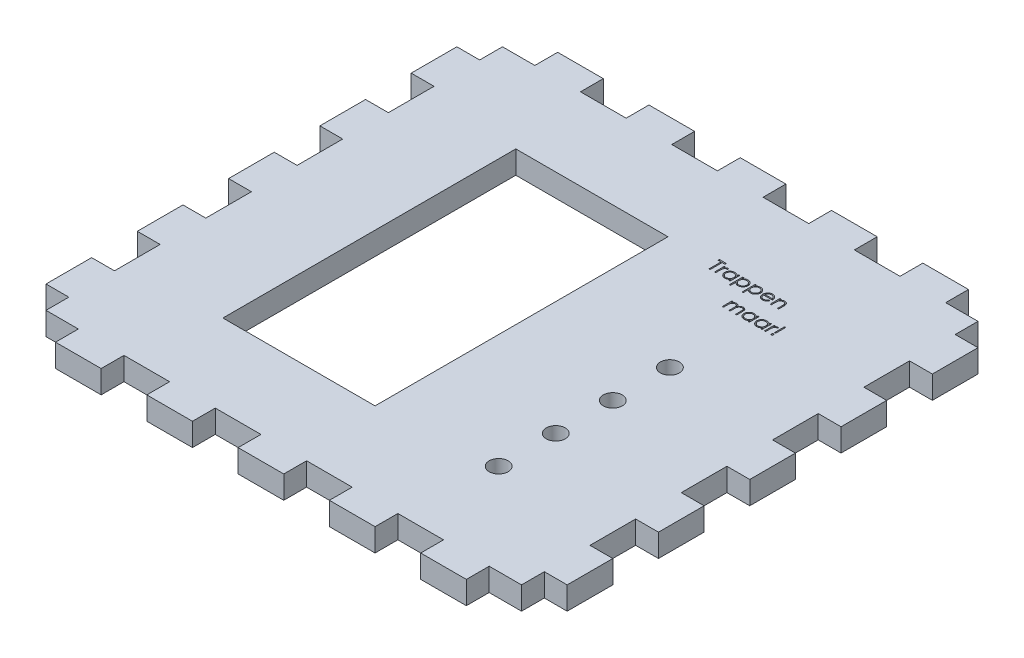
from build123d import *

# Parameters (mm, degrees)
SKETCH1_R           = 2.5
SKETCH1_W           = 40
SKETCH1_H           = 77
BOSS_EXTRUDE2_DEPTH = 6
SKETCH2_W           = 0.314102564
SKETCH2_H           = 2.692307693
CUT_EXTRUDE1_DEPTH  = 96.31133196


with BuildPart() as part:
    # Sketch1 → Boss-Extrude2 (new body)
    with BuildSketch(Plane(origin=(0, 0, 0), x_dir=(1, 0, 0), z_dir=(0, 1, 0))):
        Polygon((-62.5, -54), (-62.5, -60), (-54, -60), (-54, -66), (-42, -66), (-42, -60), (-30, -60), (-30, -66), (-18, -66), (-18, -60), (-6, -60), (-6, -66), (6, -66), (6, -60), (18, -60), (18, -66), (30, -66), (30, -60), (42, -60), (42, -66), (54, -66), (54, -60), (62.5, -60), (62.5, -54), (68.5, -54), (68.5, -42), (62.5, -42), (62.5, -30), (68.5, -30), (68.5, -18), (62.5, -18), (62.5, -6), (68.5, -6), (68.5, 6), (62.5, 6), (62.5, 18), (68.5, 18), (68.5, 30), (62.5, 30), (62.5, 42), (68.5, 42), (68.5, 54), (62.5, 54), (62.5, 60), (54, 60), (54, 66), (42, 66), (42, 60), (30, 60), (30, 66), (18, 66), (18, 60), (6, 60), (6, 66), (-6, 66), (-6, 60), (-18, 60), (-18, 66), (-30, 66), (-30, 60), (-42, 60), (-42, 66), (-54, 66), (-54, 60), (-62.5, 60), (-62.5, 54), (-68.5, 54), (-68.5, 42), (-62.5, 42), (-62.5, 30), (-68.5, 30), (-68.5, 18), (-62.5, 18), (-62.5, 6), (-68.5, 6), (-68.5, -6), (-62.5, -6), (-62.5, -18), (-68.5, -18), (-68.5, -30), (-62.5, -30), (-62.5, -42), (-68.5, -42), (-68.5, -54), align=None)
        with Locations((32.5, -36)):
            Circle(SKETCH1_R, mode=Mode.SUBTRACT)
        with Locations((32.5, -21)):
            Circle(SKETCH1_R, mode=Mode.SUBTRACT)
        with Locations((32.5, -6)):
            Circle(SKETCH1_R, mode=Mode.SUBTRACT)
        with Locations((-17.5, 0)):
            Rectangle(SKETCH1_W, SKETCH1_H, mode=Mode.SUBTRACT)
        with Locations((32.5, 9)):
            Circle(SKETCH1_R, mode=Mode.SUBTRACT)
    extrude(amount=BOSS_EXTRUDE2_DEPTH)

    # Sketch2 → Cut-Extrude1 (cut, through all)
    # profile 1 of 13: a face of its own
    with BuildSketch(Plane(origin=(0, 6, 0), x_dir=(1, 0, 0), z_dir=(0, 1, 0))):
        Polygon((14.440306719, 39.731965066), (14.440306719, 40.090939425), (16.280050309, 40.090939425), (16.280050309, 39.731965066), (15.517229796, 39.731965066), (15.517229796, 36.590939425), (15.203127232, 36.590939425), (15.203127232, 39.731965066), align=None)
    # profile 2 of 13: a face of its own
    with BuildSketch(Plane(origin=(0, 6, 0), x_dir=(1, 0, 0), z_dir=(0, 1, 0))):
        with BuildLine():
            Line((16.639024668, 39.148631733), (16.953127232, 39.148631733))
            Line((16.953127232, 39.148631733), (16.953127232, 38.772129329))
            add(Edge.make_bspline(
                [(16.953127232, 38.772129329), (16.976315991, 38.807185157), (17.020664312, 38.874229157), (17.094377241, 38.962898458), (17.169880572, 39.036313504), (17.24753576, 39.094817023), (17.327913859, 39.138630142), (17.409250811, 39.170723177), (17.492826281, 39.189700492), (17.548988205, 39.192234151), (17.577125629, 39.193503528)],
                knots=[0, 0, 0, 0, 1.2804753, 2.448899062, 3.506932113, 4.484331642, 5.4025378, 6.288909075, 7.142734305, 8, 8, 8, 8], degree=3))
            add(Edge.make_bspline(
                [(17.577125629, 39.193503528), (17.598951956, 39.192313001), (17.643861041, 39.189863415), (17.711843631, 39.172652591), (17.781887083, 39.145174568), (17.82702947, 39.119334345), (17.850563129, 39.105863303)],
                knots=[0, 0, 0, 0, 0.901110191, 1.854092781, 2.881294221, 4, 4, 4, 4], degree=3))
            Line((17.850563129, 39.105863303), (17.678087168, 38.833828047))
            add(Edge.make_bspline(
                [(17.678087168, 38.833828047), (17.662978147, 38.840568313), (17.634298332, 38.853362628), (17.592343766, 38.868504639), (17.553662429, 38.877420554), (17.529018871, 38.878771272), (17.517530277, 38.879400964)],
                knots=[0, 0, 0, 0, 1.180555205, 2.24091978, 3.179933427, 4, 4, 4, 4], degree=3))
            add(Edge.make_bspline(
                [(17.517530277, 38.879400964), (17.492324543, 38.877720926), (17.440912153, 38.874294137), (17.365427654, 38.847355329), (17.292180448, 38.803830089), (17.234008786, 38.755558977), (17.188966533, 38.70901118), (17.156826308, 38.668362777), (17.127343561, 38.622784146), (17.09917334, 38.573054462), (17.073507046, 38.518324616), (17.049552377, 38.459141402), (17.027893514, 38.395436274), (17.01554327, 38.351053753), (17.009216976, 38.328319233)],
                knots=[0, 0, 0, 0, 1.125678352, 2.296057538, 3.5422874, 4.923748041, 5.663163013, 6.437101912, 7.23742474, 8.08941207, 8.991984279, 9.93940061, 10.944477711, 12, 12, 12, 12], degree=3))
            add(Edge.make_bspline(
                [(17.009216976, 38.328319233), (17.004484582, 38.308042059), (16.99400269, 38.263129661), (16.983811153, 38.187781136), (16.973741635, 38.098757477), (16.966645016, 37.995810884), (16.960066974, 37.87919844), (16.956356892, 37.748742495), (16.953253751, 37.604309144), (16.953170685, 37.50333479), (16.953127232, 37.450514746)],
                knots=[0, 0, 0, 0, 0.566838948, 1.255505196, 2.06880316, 3.007127437, 4.065329342, 5.249902469, 6.561414163, 8, 8, 8, 8], degree=3))
            Line((16.953127232, 37.450514746), (16.953127232, 36.590939425))
            Line((16.953127232, 36.590939425), (16.639024668, 36.590939425))
            Line((16.639024668, 36.590939425), (16.639024668, 39.148631733))
        make_face()
    # profile 3 of 13: a face of its own
    with BuildSketch(Plane(origin=(0, 6, 0), x_dir=(1, 0, 0), z_dir=(0, 1, 0))):
        with BuildLine():
            Line((20.767229796, 39.148631733), (20.767229796, 36.590939425))
            Line((20.767229796, 36.590939425), (20.453127232, 36.590939425))
            Line((20.453127232, 36.590939425), (20.453127232, 37.033347278))
            add(Edge.make_bspline(
                [(20.453127232, 37.033347278), (20.417708441, 36.993307684), (20.348588226, 36.915169913), (20.233147108, 36.81308774), (20.11077893, 36.728709419), (19.982077609, 36.660559503), (19.847159366, 36.609367447), (19.706323278, 36.572981287), (19.559511898, 36.549587452), (19.459259543, 36.54725143), (19.408455758, 36.54606763)],
                knots=[0, 0, 0, 0, 1.074387032, 2.096679803, 3.090159297, 4.057316773, 5.018401886, 5.985159533, 6.978961417, 8, 8, 8, 8], degree=3))
            add(Edge.make_bspline(
                [(19.408455758, 36.54606763), (19.363287804, 36.547294002), (19.274214599, 36.549712463), (19.143185522, 36.568474767), (19.017093272, 36.598605388), (18.8958187, 36.640506278), (18.780146554, 36.696087099), (18.669086458, 36.762628347), (18.563213765, 36.841869177), (18.464142227, 36.932457206), (18.372910226, 37.030852193), (18.292848954, 37.13579774), (18.226095874, 37.246840044), (18.170275793, 37.362573198), (18.127279449, 37.483888117), (18.097305814, 37.610365285), (18.078565368, 37.741855159), (18.076147907, 37.831394682), (18.074922104, 37.876796797)],
                knots=[0, 0, 0, 0, 1.033919861, 2.038935746, 3.024066025, 3.998881131, 4.97069526, 5.957263378, 6.95902576, 7.993208707, 9.027059324, 10.027763471, 11.009749337, 11.988697705, 12.965288445, 13.950418724, 14.960734635, 16, 16, 16, 16], degree=3))
            add(Edge.make_bspline(
                [(18.074922104, 37.876796797), (18.076175075, 37.9212605), (18.078652132, 38.009162844), (18.097105352, 38.138441542), (18.12813636, 38.262959802), (18.171684208, 38.382316746), (18.227526163, 38.496656796), (18.29545425, 38.606060821), (18.375473375, 38.710830218), (18.467725782, 38.808501445), (18.567660552, 38.898722059), (18.674569283, 38.977131105), (18.785792564, 39.044847954), (18.903055575, 39.09850143), (19.02462268, 39.141910535), (19.151576125, 39.171943503), (19.283387704, 39.189640824), (19.372878196, 39.192203588), (19.418271463, 39.193503528)],
                knots=[0, 0, 0, 0, 1.020392517, 2.01726096, 2.990465484, 3.961182959, 4.928053699, 5.906110375, 6.912531644, 7.948652711, 8.985773172, 9.998621852, 10.987621588, 11.969261332, 12.953316658, 13.946091881, 14.958173133, 16, 16, 16, 16], degree=3))
            add(Edge.make_bspline(
                [(19.418271463, 39.193503528), (19.470471322, 39.192065776), (19.572832782, 39.189246413), (19.722560791, 39.165783686), (19.864205269, 39.126145219), (19.998859621, 39.072227721), (20.126040307, 39.000578992), (20.244543291, 38.910199031), (20.355608775, 38.801657844), (20.419989066, 38.718287399), (20.453127232, 38.675374521)],
                knots=[0, 0, 0, 0, 1.038897134, 2.037228247, 3.008116434, 3.962042015, 4.918381754, 5.904844433, 6.921570401, 8, 8, 8, 8], degree=3))
            Line((20.453127232, 38.675374521), (20.453127232, 39.148631733))
            Line((20.453127232, 39.148631733), (20.767229796, 39.148631733))
        make_face()
        with BuildLine():
            add(Edge.make_bspline(
                [(19.422478193, 38.879400964), (19.376563856, 38.877767326), (19.285936256, 38.874542785), (19.152892254, 38.84936929), (19.025578839, 38.807484695), (18.904632765, 38.750202794), (18.791964549, 38.678174057), (18.691270878, 38.591052674), (18.601728176, 38.49121566), (18.526419912, 38.37911355), (18.465029415, 38.258935459), (18.421862383, 38.13331102), (18.393393136, 38.004506043), (18.390484615, 37.917143357), (18.389024668, 37.873291188)],
                knots=[0, 0, 0, 0, 1.031046209, 2.035121221, 3.029706178, 4.034933723, 5.034054252, 6.02443088, 7.017295772, 8.038157696, 9.050218397, 10.03989886, 11.016116709, 12, 12, 12, 12], degree=3))
            add(Edge.make_bspline(
                [(18.389024668, 37.873291188), (18.390889561, 37.829701081), (18.394612038, 37.742691725), (18.421362732, 37.613711148), (18.466242606, 37.488057106), (18.527484669, 37.366796113), (18.604171293, 37.254212012), (18.693059946, 37.15247189), (18.795010227, 37.064982301), (18.907937734, 36.991744728), (19.028545705, 36.932582207), (19.155379636, 36.891416567), (19.286055274, 36.864838787), (19.374907608, 36.86173431), (19.419673706, 36.860170194)],
                knots=[0, 0, 0, 0, 0.979072187, 1.954306742, 2.945804271, 3.96968567, 4.997920485, 5.998718438, 6.996577872, 8.005894225, 9.015743152, 10.005417472, 10.995077863, 12, 12, 12, 12], degree=3))
            add(Edge.make_bspline(
                [(19.419673706, 36.860170194), (19.465120209, 36.861830158), (19.555508796, 36.865131662), (19.688947503, 36.890412927), (19.818442466, 36.932181726), (19.942229695, 36.990080852), (20.057545826, 37.061838208), (20.161043703, 37.145845299), (20.248559672, 37.243548483), (20.322752281, 37.350924936), (20.380927698, 37.468636933), (20.423303757, 37.593971124), (20.448357663, 37.726931872), (20.451515393, 37.817795799), (20.453127232, 37.864176605)],
                knots=[0, 0, 0, 0, 1.01762866, 2.023962475, 3.030623092, 4.058876274, 5.077231937, 6.066672613, 7.034107872, 8.005628644, 8.981990164, 9.965428785, 10.961468474, 12, 12, 12, 12], degree=3))
            add(Edge.make_bspline(
                [(20.453127232, 37.864176605), (20.452167576, 37.899514435), (20.450278668, 37.969070468), (20.435848099, 38.071197986), (20.412893172, 38.168931712), (20.380547002, 38.262374401), (20.338055718, 38.351009416), (20.286807952, 38.435473177), (20.225902502, 38.515326388), (20.156319806, 38.589469459), (20.080154604, 38.657095921), (19.999560063, 38.717460162), (19.913581316, 38.767048935), (19.823664279, 38.808090206), (19.729652945, 38.840749356), (19.630782325, 38.86253705), (19.528103338, 38.877497371), (19.458057282, 38.878759752), (19.422478193, 38.879400964)],
                knots=[0, 0, 0, 0, 1.050140795, 2.067009409, 3.05949893, 4.030605086, 5.00011959, 5.97591094, 6.962425594, 7.979863591, 8.993523472, 9.986985069, 10.967611495, 11.937549037, 12.921786183, 13.919465291, 14.943216303, 16, 16, 16, 16], degree=3))
        make_face(mode=Mode.SUBTRACT)
    # profile 4 of 13: a face of its own
    with BuildSketch(Plane(origin=(0, 6, 0), x_dir=(1, 0, 0), z_dir=(0, 1, 0))):
        with BuildLine():
            Line((21.485178514, 39.148631733), (21.799281078, 39.148631733))
            Line((21.799281078, 39.148631733), (21.799281078, 38.675374521))
            add(Edge.make_bspline(
                [(21.799281078, 38.675374521), (21.832638562, 38.718312255), (21.897462157, 38.801753148), (22.009187062, 38.909743277), (22.127113871, 39.00081858), (22.254277283, 39.072201113), (22.388700973, 39.126021925), (22.529833291, 39.165801375), (22.678872055, 39.18924285), (22.780768508, 39.192064511), (22.832734604, 39.193503528)],
                knots=[0, 0, 0, 0, 1.0828784, 2.104357462, 3.088488658, 4.04616522, 5.001424249, 5.969181776, 6.964304535, 8, 8, 8, 8], degree=3))
            add(Edge.make_bspline(
                [(22.832734604, 39.193503528), (22.878126207, 39.192190349), (22.967845095, 39.189594782), (23.099908324, 39.172021727), (23.227083708, 39.141904035), (23.348651762, 39.098503119), (23.465914827, 39.044847649), (23.577136927, 38.977130614), (23.684050482, 38.898724423), (23.783966671, 38.808492272), (23.876288039, 38.710864006), (23.95613422, 38.605841702), (24.025006124, 38.496879115), (24.080676421, 38.382287023), (24.124284768, 38.262967793), (24.155299446, 38.138439352), (24.173757089, 38.009163412), (24.176233541, 37.921260691), (24.177486206, 37.876796797)],
                knots=[0, 0, 0, 0, 1.041296284, 2.058176809, 3.050446431, 4.034000596, 5.01514041, 6.003636468, 7.015969324, 8.052561599, 9.08815499, 10.094063707, 11.074456064, 12.040834395, 13.011057502, 13.983766392, 14.980127149, 16, 16, 16, 16], degree=3))
            add(Edge.make_bspline(
                [(24.177486206, 37.876796797), (24.176260721, 37.831394488), (24.173843886, 37.741854584), (24.15509888, 37.610367487), (24.125142006, 37.483880113), (24.082083823, 37.362602849), (24.026442335, 37.246619198), (23.958737774, 37.136012802), (23.878851307, 37.030819099), (23.78755018, 36.932466199), (23.688497244, 36.841866886), (23.582619754, 36.762628816), (23.471560829, 36.696087441), (23.355888661, 36.640504481), (23.234613023, 36.598612297), (23.108299745, 36.568394497), (22.977017599, 36.549760001), (22.887716447, 36.547307858), (22.842550309, 36.54606763)],
                knots=[0, 0, 0, 0, 1.038740735, 2.04854663, 3.033179607, 4.009277356, 4.987731542, 5.972001279, 6.972200261, 8.005528982, 9.039189865, 10.040446548, 11.026516639, 11.997840187, 12.972163198, 13.956796175, 14.96660207, 16, 16, 16, 16], degree=3))
            add(Edge.make_bspline(
                [(22.842550309, 36.54606763), (22.791722737, 36.547362438), (22.691323381, 36.549920063), (22.54452571, 36.575839473), (22.403248859, 36.614576408), (22.269058034, 36.671275402), (22.140890221, 36.743530918), (22.019470416, 36.831641124), (21.904153663, 36.935421749), (21.834744905, 37.014153565), (21.799281078, 37.054380932)],
                knots=[0, 0, 0, 0, 1.014726462, 2.004382257, 2.969841629, 3.936926163, 4.907207904, 5.903978561, 6.929055279, 8, 8, 8, 8], degree=3))
            Line((21.799281078, 37.054380932), (21.799281078, 35.648631733))
            Line((21.799281078, 35.648631733), (21.485178514, 35.648631733))
            Line((21.485178514, 35.648631733), (21.485178514, 39.148631733))
        make_face()
        with BuildLine():
            add(Edge.make_bspline(
                [(22.829930117, 38.879400964), (22.794350554, 38.878760705), (22.724303566, 38.877500202), (22.621631347, 38.862526253), (22.52273592, 38.840788512), (22.428613968, 38.807876612), (22.338363352, 38.767477799), (22.252679187, 38.716995787), (22.171621619, 38.657343782), (22.095394589, 38.589664438), (22.026531296, 38.515089749), (21.965568368, 38.43550194), (21.914361062, 38.351001801), (21.871859042, 38.262376438), (21.83951576, 38.168931153), (21.81656004, 38.07119814), (21.802129687, 37.969070428), (21.80024075, 37.899514421), (21.799281078, 37.864176605)],
                knots=[0, 0, 0, 0, 1.05670511, 2.080379991, 3.077984906, 4.06214886, 5.038337365, 6.01289324, 7.01187578, 8.025460281, 9.038092164, 10.024533457, 11.000252242, 11.969694649, 12.940728589, 13.933144304, 14.949937299, 16, 16, 16, 16], degree=3))
            add(Edge.make_bspline(
                [(21.799281078, 37.864176605), (21.800871934, 37.817788492), (21.803988556, 37.726910251), (21.829325924, 37.594126129), (21.870561188, 37.468474473), (21.929089902, 37.351013436), (22.003037476, 37.243030601), (22.092135632, 37.146339995), (22.195578183, 37.061549404), (22.311645375, 36.99012815), (22.436067506, 36.932140084), (22.565853418, 36.890625873), (22.699218299, 36.865053645), (22.789386618, 36.861806826), (22.834837969, 36.860170194)],
                knots=[0, 0, 0, 0, 1.03728447, 2.032128127, 3.01272805, 3.987917167, 4.958271349, 5.931593992, 6.91984656, 7.941419022, 8.973179163, 9.983609215, 10.983593296, 12, 12, 12, 12], degree=3))
            add(Edge.make_bspline(
                [(22.834837969, 36.860170194), (22.879373737, 36.861726571), (22.96776923, 36.8648157), (23.097927352, 36.891553887), (23.22441799, 36.932398912), (23.344598162, 36.991958468), (23.45742165, 37.064948526), (23.559303204, 37.152508559), (23.648310117, 37.253998502), (23.724174472, 37.367007005), (23.785305958, 37.488182389), (23.831236198, 37.613563778), (23.857744771, 37.742709201), (23.861501559, 37.829706914), (23.863383642, 37.873291188)],
                knots=[0, 0, 0, 0, 1.00104056, 1.986885549, 2.97790532, 3.984399681, 4.995088187, 5.994304198, 6.996462723, 8.023150851, 9.048424203, 10.043036403, 11.019596776, 12, 12, 12, 12], degree=3))
            add(Edge.make_bspline(
                [(23.863383642, 37.873291188), (23.861928908, 37.917146177), (23.859030775, 38.004514481), (23.830483737, 38.133277384), (23.787583759, 38.25916536), (23.725024707, 38.37868591), (23.650823438, 38.491459992), (23.561076441, 38.591013871), (23.460460244, 38.678184544), (23.34777108, 38.750199954), (23.226830655, 38.807485449), (23.099515739, 38.849369088), (22.966472137, 38.874542837), (22.875844482, 38.877767343), (22.829930117, 38.879400964)],
                knots=[0, 0, 0, 0, 0.983928682, 1.960191568, 2.949917689, 3.96440592, 4.982380491, 5.975291189, 6.965713506, 7.964880129, 8.970154049, 9.96478489, 10.968906225, 12, 12, 12, 12], degree=3))
        make_face(mode=Mode.SUBTRACT)
    # profile 5 of 13: a face of its own
    with BuildSketch(Plane(origin=(0, 6, 0), x_dir=(1, 0, 0), z_dir=(0, 1, 0))):
        with BuildLine():
            Line((24.805691335, 39.148631733), (25.119793899, 39.148631733))
            Line((25.119793899, 39.148631733), (25.119793899, 38.675374521))
            add(Edge.make_bspline(
                [(25.119793899, 38.675374521), (25.153151383, 38.718312255), (25.217974977, 38.801753148), (25.329699882, 38.909743277), (25.447626691, 39.00081858), (25.574790104, 39.072201113), (25.709213794, 39.126021925), (25.850346111, 39.165801375), (25.999384876, 39.18924285), (26.101281329, 39.192064511), (26.153247424, 39.193503528)],
                knots=[0, 0, 0, 0, 1.0828784, 2.104357462, 3.088488658, 4.04616522, 5.001424249, 5.969181776, 6.964304535, 8, 8, 8, 8], degree=3))
            add(Edge.make_bspline(
                [(26.153247424, 39.193503528), (26.198639027, 39.192190349), (26.288357916, 39.189594782), (26.420421145, 39.172021727), (26.547596528, 39.141904035), (26.669164582, 39.098503119), (26.786427647, 39.044847649), (26.897649747, 38.977130614), (27.004563303, 38.898724423), (27.104479492, 38.808492272), (27.196800859, 38.710864006), (27.276647041, 38.605841702), (27.345518945, 38.496879115), (27.401189241, 38.382287023), (27.444797589, 38.262967793), (27.475812266, 38.138439352), (27.49426991, 38.009163412), (27.496746362, 37.921260691), (27.497999027, 37.876796797)],
                knots=[0, 0, 0, 0, 1.041296284, 2.058176809, 3.050446431, 4.034000596, 5.01514041, 6.003636468, 7.015969324, 8.052561599, 9.08815499, 10.094063707, 11.074456064, 12.040834395, 13.011057502, 13.983766392, 14.980127149, 16, 16, 16, 16], degree=3))
            add(Edge.make_bspline(
                [(27.497999027, 37.876796797), (27.496773541, 37.831394488), (27.494356707, 37.741854584), (27.475611701, 37.610367487), (27.445654827, 37.483880113), (27.402596644, 37.362602849), (27.346955155, 37.246619198), (27.279250595, 37.136012802), (27.199364128, 37.030819099), (27.108063, 36.932466199), (27.009010064, 36.841866886), (26.903132575, 36.762628816), (26.792073649, 36.696087441), (26.676401482, 36.640504481), (26.555125843, 36.598612297), (26.428812566, 36.568394497), (26.297530419, 36.549760001), (26.208229267, 36.547307858), (26.163063129, 36.54606763)],
                knots=[0, 0, 0, 0, 1.038740735, 2.04854663, 3.033179607, 4.009277356, 4.987731542, 5.972001279, 6.972200261, 8.005528982, 9.039189865, 10.040446548, 11.026516639, 11.997840187, 12.972163198, 13.956796175, 14.96660207, 16, 16, 16, 16], degree=3))
            add(Edge.make_bspline(
                [(26.163063129, 36.54606763), (26.112235557, 36.547362438), (26.011836201, 36.549920063), (25.865038531, 36.575839473), (25.723761679, 36.614576408), (25.589570854, 36.671275402), (25.461403042, 36.743530918), (25.339983236, 36.831641124), (25.224666483, 36.935421749), (25.155257726, 37.014153565), (25.119793899, 37.054380932)],
                knots=[0, 0, 0, 0, 1.014726462, 2.004382257, 2.969841629, 3.936926163, 4.907207904, 5.903978561, 6.929055279, 8, 8, 8, 8], degree=3))
            Line((25.119793899, 37.054380932), (25.119793899, 35.648631733))
            Line((25.119793899, 35.648631733), (24.805691335, 35.648631733))
            Line((24.805691335, 35.648631733), (24.805691335, 39.148631733))
        make_face()
        with BuildLine():
            add(Edge.make_bspline(
                [(26.150442937, 38.879400964), (26.114863375, 38.878760705), (26.044816387, 38.877500202), (25.942144168, 38.862526253), (25.84324874, 38.840788512), (25.749126789, 38.807876612), (25.658876172, 38.767477799), (25.573192007, 38.716995787), (25.49213444, 38.657343782), (25.415907409, 38.589664438), (25.347044116, 38.515089749), (25.286081188, 38.43550194), (25.234873883, 38.351001801), (25.192371863, 38.262376438), (25.16002858, 38.168931153), (25.13707286, 38.07119814), (25.122642507, 37.969070428), (25.12075357, 37.899514421), (25.119793899, 37.864176605)],
                knots=[0, 0, 0, 0, 1.05670511, 2.080379991, 3.077984906, 4.06214886, 5.038337365, 6.01289324, 7.01187578, 8.025460281, 9.038092164, 10.024533457, 11.000252242, 11.969694649, 12.940728589, 13.933144304, 14.949937299, 16, 16, 16, 16], degree=3))
            add(Edge.make_bspline(
                [(25.119793899, 37.864176605), (25.121384755, 37.817788492), (25.124501377, 37.726910251), (25.149838745, 37.594126129), (25.191074009, 37.468474473), (25.249602722, 37.351013436), (25.323550297, 37.243030601), (25.412648453, 37.146339995), (25.516091004, 37.061549404), (25.632158196, 36.99012815), (25.756580326, 36.932140084), (25.886366238, 36.890625873), (26.019731119, 36.865053645), (26.109899439, 36.861806826), (26.15535079, 36.860170194)],
                knots=[0, 0, 0, 0, 1.03728447, 2.032128127, 3.01272805, 3.987917167, 4.958271349, 5.931593992, 6.91984656, 7.941419022, 8.973179163, 9.983609215, 10.983593296, 12, 12, 12, 12], degree=3))
            add(Edge.make_bspline(
                [(26.15535079, 36.860170194), (26.199886558, 36.861726571), (26.288282051, 36.8648157), (26.418440172, 36.891553887), (26.54493081, 36.932398912), (26.665110983, 36.991958468), (26.777934471, 37.064948526), (26.879816024, 37.152508559), (26.968822938, 37.253998502), (27.044687293, 37.367007005), (27.105818778, 37.488182389), (27.151749018, 37.613563778), (27.178257591, 37.742709201), (27.18201438, 37.829706914), (27.183896463, 37.873291188)],
                knots=[0, 0, 0, 0, 1.00104056, 1.986885549, 2.97790532, 3.984399681, 4.995088187, 5.994304198, 6.996462723, 8.023150851, 9.048424203, 10.043036403, 11.019596776, 12, 12, 12, 12], degree=3))
            add(Edge.make_bspline(
                [(27.183896463, 37.873291188), (27.182441729, 37.917146177), (27.179543595, 38.004514481), (27.150996557, 38.133277384), (27.10809658, 38.25916536), (27.045537528, 38.37868591), (26.971336258, 38.491459992), (26.881589261, 38.591013871), (26.780973065, 38.678184544), (26.668283901, 38.750199954), (26.547343475, 38.807485449), (26.42002856, 38.849369088), (26.286984957, 38.874542837), (26.196357303, 38.877767343), (26.150442937, 38.879400964)],
                knots=[0, 0, 0, 0, 0.983928682, 1.960191568, 2.949917689, 3.96440592, 4.982380491, 5.975291189, 6.965713506, 7.964880129, 8.970154049, 9.96478489, 10.968906225, 12, 12, 12, 12], degree=3))
        make_face(mode=Mode.SUBTRACT)
    # profile 6 of 13: a face of its own
    with BuildSketch(Plane(origin=(0, 6, 0), x_dir=(1, 0, 0), z_dir=(0, 1, 0))):
        with BuildLine():
            Line((30.225362809, 37.398631733), (30.504409283, 37.252097278))
            add(Edge.make_bspline(
                [(30.504409283, 37.252097278), (30.482172688, 37.212653946), (30.43890908, 37.135912844), (30.364508332, 37.030480983), (30.286516259, 36.935633267), (30.201412291, 36.853903613), (30.111742612, 36.782652228), (30.017009957, 36.720314403), (29.91672114, 36.667195883), (29.810871415, 36.622443355), (29.698571864, 36.588033861), (29.579550347, 36.56372964), (29.453578852, 36.548706371), (29.367232672, 36.546961231), (29.323019059, 36.54606763)],
                knots=[0, 0, 0, 0, 1.120438281, 2.179929193, 3.190490725, 4.156257408, 5.095198341, 6.022838206, 6.959905092, 7.901321166, 8.864066838, 9.862729781, 10.905609505, 12, 12, 12, 12], degree=3))
            add(Edge.make_bspline(
                [(29.323019059, 36.54606763), (29.273877081, 36.547214806), (29.17801532, 36.549452612), (29.038475573, 36.568745077), (28.907096154, 36.600217435), (28.783884451, 36.644182977), (28.669142198, 36.701610301), (28.562641343, 36.771569783), (28.463821818, 36.853702037), (28.375797608, 36.948718481), (28.296553726, 37.050400438), (28.226627906, 37.156356323), (28.168170475, 37.266319547), (28.120617864, 37.379590071), (28.082212999, 37.495453965), (28.055446296, 37.614965432), (28.040016548, 37.737801017), (28.037652102, 37.820898352), (28.036460565, 37.862774361)],
                knots=[0, 0, 0, 0, 1.145258523, 2.234067595, 3.276747158, 4.290159414, 5.277019952, 6.260822364, 7.254936242, 8.264827045, 9.274100331, 10.257902744, 11.220704747, 12.172965371, 13.118907548, 14.062713208, 15.023725156, 16, 16, 16, 16], degree=3))
            add(Edge.make_bspline(
                [(28.036460565, 37.862774361), (28.037519707, 37.902069191), (28.039618785, 37.979946356), (28.052849572, 38.095211901), (28.076297865, 38.207240353), (28.108474189, 38.316124801), (28.150025435, 38.421682935), (28.200857655, 38.523978999), (28.261050032, 38.622904139), (28.307522706, 38.685307272), (28.330931719, 38.716740707)],
                knots=[0, 0, 0, 0, 1.024358464, 2.0301432, 3.019427413, 4.004406732, 4.986367066, 5.972626655, 6.978780325, 8, 8, 8, 8], degree=3))
            add(Edge.make_bspline(
                [(28.330931719, 38.716740707), (28.362639402, 38.754609577), (28.425050349, 38.829147728), (28.530606704, 38.927086053), (28.6449069, 39.009129829), (28.766518526, 39.077136965), (28.896855, 39.128810612), (29.034164291, 39.167318194), (29.180009878, 39.188896205), (29.279715098, 39.191944039), (29.330731399, 39.193503528)],
                knots=[0, 0, 0, 0, 1.030682036, 2.02871468, 2.997146059, 3.962720338, 4.930598197, 5.918074684, 6.934738563, 8, 8, 8, 8], degree=3))
            add(Edge.make_bspline(
                [(29.330731399, 39.193503528), (29.383179004, 39.192149479), (29.48606925, 39.189493143), (29.636101371, 39.16486681), (29.778062087, 39.125814256), (29.911894592, 39.070660465), (30.037612453, 38.999500913), (30.154398502, 38.911359072), (30.264250015, 38.808940985), (30.328158593, 38.730177775), (30.360679315, 38.690098079)],
                knots=[0, 0, 0, 0, 1.056321875, 2.072262726, 3.055038591, 4.01806755, 4.982017516, 5.957941055, 6.960871419, 8, 8, 8, 8], degree=3))
            add(Edge.make_bspline(
                [(30.360679315, 38.690098079), (30.382806254, 38.659894498), (30.426912847, 38.599688379), (30.482159947, 38.501517222), (30.530117342, 38.398806627), (30.568450303, 38.28989633), (30.599489804, 38.17607675), (30.621946623, 38.056534205), (30.635116241, 37.931304294), (30.637704939, 37.845977739), (30.639024668, 37.802477887)],
                knots=[0, 0, 0, 0, 0.94817472, 1.890038105, 2.849395472, 3.817997239, 4.812318967, 5.836947057, 6.897266129, 8, 8, 8, 8], degree=3))
            Line((30.639024668, 37.802477887), (28.350563129, 37.802477887))
            add(Edge.make_bspline(
                [(28.350563129, 37.802477887), (28.352102736, 37.768777422), (28.35513031, 37.702506819), (28.369245453, 37.605536036), (28.391494227, 37.513162693), (28.422763289, 37.426079651), (28.460630135, 37.343149524), (28.507015851, 37.264987487), (28.562355405, 37.191949557), (28.624081105, 37.123382419), (28.6927882, 37.062321658), (28.765070947, 37.007669882), (28.841964512, 36.961864285), (28.922862596, 36.924684395), (29.007634381, 36.895578079), (29.096306576, 36.875710259), (29.188704692, 36.862403152), (29.251690426, 36.860923487), (29.283756238, 36.860170194)],
                knots=[0, 0, 0, 0, 1.094153842, 2.151609401, 3.174256925, 4.172055639, 5.149267565, 6.128595816, 7.11444997, 8.118368179, 9.117203808, 10.09244225, 11.054858984, 12.015122123, 12.976791628, 13.957293641, 14.960065497, 16, 16, 16, 16], degree=3))
            add(Edge.make_bspline(
                [(29.283756238, 36.860170194), (29.315107386, 36.860778251), (29.377314077, 36.861984752), (29.469954934, 36.873716663), (29.561094462, 36.892686939), (29.650355445, 36.918576929), (29.735926291, 36.950153781), (29.815171841, 36.988256638), (29.888052057, 37.030406385), (29.956169023, 37.07861606), (30.022240016, 37.137624247), (30.087782503, 37.211259968), (30.158059156, 37.298347496), (30.202048749, 37.363893162), (30.225362809, 37.398631733)],
                knots=[0, 0, 0, 0, 0.99110716, 1.966546729, 2.947904876, 3.932708344, 4.903319531, 5.828989031, 6.710028674, 7.56322171, 8.463672341, 9.504779593, 10.677557249, 12, 12, 12, 12], degree=3))
        make_face()
        with BuildLine():
            add(Edge.make_bspline(
                [(30.324922104, 38.116580451), (30.313425479, 38.158243324), (30.291298178, 38.238430945), (30.245061813, 38.349471835), (30.192990273, 38.448159736), (30.131368541, 38.53373937), (30.061549816, 38.609742883), (29.980904633, 38.676161468), (29.890468739, 38.735578919), (29.790709599, 38.785731418), (29.685067814, 38.828421277), (29.574461622, 38.857046393), (29.461603834, 38.876655935), (29.385269547, 38.878482043), (29.3468572, 38.879400964)],
                knots=[0, 0, 0, 0, 1.154881502, 2.222775134, 3.210006277, 4.132804581, 5.035138423, 5.962687519, 6.919655026, 7.923214229, 8.944639381, 9.960483929, 10.97369054, 12, 12, 12, 12], degree=3))
            add(Edge.make_bspline(
                [(29.3468572, 38.879400964), (29.315507761, 38.878789292), (29.253536512, 38.877580146), (29.162235444, 38.866110017), (29.074555745, 38.847150172), (28.989850458, 38.821185215), (28.909229589, 38.786576613), (28.831034821, 38.745993386), (28.757254425, 38.696451802), (28.711113129, 38.658692947), (28.687802713, 38.63961731)],
                knots=[0, 0, 0, 0, 1.04873581, 2.073130211, 3.073294108, 4.04793562, 5.032784715, 6.005352987, 6.992311501, 8, 8, 8, 8], degree=3))
            add(Edge.make_bspline(
                [(28.687802713, 38.63961731), (28.671109431, 38.624522994), (28.637326297, 38.593975778), (28.592185775, 38.541346571), (28.548965302, 38.484595009), (28.50963165, 38.421549885), (28.473554063, 38.352929106), (28.439794086, 38.27931147), (28.409407674, 38.20013834), (28.392311564, 38.144965901), (28.383515854, 38.116580451)],
                knots=[0, 0, 0, 0, 0.879870761, 1.780643979, 2.707998968, 3.669668524, 4.684282772, 5.740141944, 6.837334558, 8, 8, 8, 8], degree=3))
            Line((28.383515854, 38.116580451), (30.324922104, 38.116580451))
        make_face(mode=Mode.SUBTRACT)
    # profile 7 of 13: a face of its own
    with BuildSketch(Plane(origin=(0, 6, 0), x_dir=(1, 0, 0), z_dir=(0, 1, 0))):
        with BuildLine():
            Line((31.267229796, 39.148631733), (31.58133236, 39.148631733))
            Line((31.58133236, 39.148631733), (31.58133236, 38.687293592))
            add(Edge.make_bspline(
                [(31.58133236, 38.687293592), (31.614869995, 38.729136315), (31.679950946, 38.810333578), (31.78833528, 38.917054153), (31.90287918, 39.004999378), (32.022881183, 39.075103172), (32.148504194, 39.127949798), (32.278982463, 39.166115729), (32.41509717, 39.189000557), (32.507661606, 39.191990788), (32.554489411, 39.193503528)],
                knots=[0, 0, 0, 0, 1.12780773, 2.188550248, 3.19190651, 4.159438251, 5.104880172, 6.052711206, 7.014878035, 8, 8, 8, 8], degree=3))
            add(Edge.make_bspline(
                [(32.554489411, 39.193503528), (32.601820046, 39.191758332), (32.694457513, 39.188342564), (32.829335575, 39.161325873), (32.955308968, 39.115180618), (33.071928524, 39.051968547), (33.177055738, 38.973362074), (33.269380589, 38.881784292), (33.345743836, 38.776448209), (33.396941199, 38.678725052), (33.430666847, 38.592036258), (33.451899185, 38.517789508), (33.469930166, 38.435071357), (33.485561914, 38.344131768), (33.496139026, 38.244333578), (33.504481317, 38.136085886), (33.510460012, 38.019423755), (33.510697219, 37.938737128), (33.51081954, 37.897129329)],
                knots=[0, 0, 0, 0, 1.235846778, 2.418850247, 3.575807741, 4.728682307, 5.871620074, 6.994088408, 8.11269785, 9.256955736, 9.865816715, 10.540099792, 11.271859618, 12.076849838, 12.949306005, 13.892391288, 14.913166135, 16, 16, 16, 16], degree=3))
            Line((33.51081954, 37.897129329), (33.51081954, 36.590939425))
            Line((33.51081954, 36.590939425), (33.196716976, 36.590939425))
            Line((33.196716976, 36.590939425), (33.196716976, 37.794064425))
            add(Edge.make_bspline(
                [(33.196716976, 37.794064425), (33.196523768, 37.82888687), (33.196154193, 37.895496281), (33.194988547, 37.990865304), (33.19217874, 38.077351882), (33.188230427, 38.15474925), (33.182451397, 38.222983086), (33.176428765, 38.282192363), (33.169063789, 38.332301906), (33.162500875, 38.362466988), (33.15955752, 38.375995515)],
                knots=[0, 0, 0, 0, 1.430800155, 2.736877192, 3.918605307, 4.986035426, 5.920637409, 6.731861385, 7.431261377, 8, 8, 8, 8], degree=3))
            add(Edge.make_bspline(
                [(33.15955752, 38.375995515), (33.148931989, 38.4157067), (33.128481128, 38.492138444), (33.077947145, 38.595812797), (33.014132964, 38.684010985), (32.936235115, 38.756187706), (32.845006039, 38.812358543), (32.740698897, 38.851332498), (32.624320256, 38.875708767), (32.542465873, 38.878135899), (32.499801911, 38.879400964)],
                knots=[0, 0, 0, 0, 1.084156227, 2.086665306, 3.027808233, 3.945421172, 4.874247719, 5.839848303, 6.874090471, 8, 8, 8, 8], degree=3))
            add(Edge.make_bspline(
                [(32.499801911, 38.879400964), (32.474534228, 38.878924959), (32.424530135, 38.877982958), (32.350380163, 38.86853166), (32.27845599, 38.853073204), (32.208035781, 38.832204567), (32.140527987, 38.803542298), (32.073763696, 38.771012927), (32.010256932, 38.730464715), (31.948653535, 38.685274094), (31.891340727, 38.635194887), (31.838012389, 38.582350377), (31.790474368, 38.526074773), (31.747405693, 38.467274825), (31.71022743, 38.405142987), (31.677774342, 38.340278681), (31.650238647, 38.272596532), (31.636555954, 38.225621471), (31.629709764, 38.20211731)],
                knots=[0, 0, 0, 0, 1.023777757, 2.026029729, 3.023749952, 4.003683103, 4.997618607, 5.993177895, 7.010360494, 8.046726602, 9.087585522, 10.09234134, 11.086953743, 12.070360549, 13.043493632, 14.017870808, 15.008233677, 16, 16, 16, 16], degree=3))
            add(Edge.make_bspline(
                [(31.629709764, 38.20211731), (31.625770115, 38.184862107), (31.617193707, 38.147298432), (31.607930527, 38.085654013), (31.599522951, 38.014344038), (31.592485993, 37.933451721), (31.588180576, 37.842693846), (31.583486179, 37.742458008), (31.581777118, 37.63234452), (31.581484764, 37.555682827), (31.58133236, 37.515719073)],
                knots=[0, 0, 0, 0, 0.615963638, 1.340920617, 2.168419149, 3.115676021, 4.16674242, 5.331190069, 6.6087489, 8, 8, 8, 8], degree=3))
            Line((31.58133236, 37.515719073), (31.58133236, 36.590939425))
            Line((31.58133236, 36.590939425), (31.267229796, 36.590939425))
            Line((31.267229796, 36.590939425), (31.267229796, 39.148631733))
        make_face()
    # profile 8 of 13: a face of its own
    with BuildSketch(Plane(origin=(0, 6, 0), x_dir=(1, 0, 0), z_dir=(0, 1, 0))):
        with BuildLine():
            Line((25.523640052, 32.315298399), (25.837742617, 32.315298399))
            Line((25.837742617, 32.315298399), (25.837742617, 31.870787182))
            add(Edge.make_bspline(
                [(25.837742617, 31.870787182), (25.866026566, 31.909674783), (25.920221326, 31.984187156), (26.009086979, 32.082377441), (26.097863091, 32.165705595), (26.161796473, 32.209448467), (26.192510245, 32.230462662)],
                knots=[0, 0, 0, 0, 1.134379233, 2.173579362, 3.122582517, 4, 4, 4, 4], degree=3))
            add(Edge.make_bspline(
                [(26.192510245, 32.230462662), (26.234374907, 32.250468028), (26.317372807, 32.290129241), (26.448792032, 32.3303628), (26.583266701, 32.355087901), (26.674074915, 32.358469275), (26.719753835, 32.360170194)],
                knots=[0, 0, 0, 0, 1.014936303, 2.012140481, 3.000054389, 4, 4, 4, 4], degree=3))
            add(Edge.make_bspline(
                [(26.719753835, 32.360170194), (26.750646831, 32.359124904), (26.81178241, 32.357056329), (26.9023665, 32.343596294), (26.990225112, 32.320330121), (27.074839141, 32.287922797), (27.154559821, 32.24867611), (27.227649018, 32.202626402), (27.293273227, 32.150929327), (27.351399278, 32.091250394), (27.403668303, 32.021913795), (27.45174715, 31.941049546), (27.496172362, 31.846841885), (27.520793671, 31.778475344), (27.533756238, 31.742481893)],
                knots=[0, 0, 0, 0, 1.009824226, 1.998387844, 2.986035974, 3.974953746, 4.955485308, 5.885931332, 6.793869504, 7.679848016, 8.601185859, 9.625726857, 10.749998409, 12, 12, 12, 12], degree=3))
            add(Edge.make_bspline(
                [(27.533756238, 31.742481893), (27.54746749, 31.767206312), (27.574449307, 31.815860497), (27.619754944, 31.88471876), (27.66722274, 31.949125551), (27.717257233, 32.009131976), (27.76968182, 32.064441706), (27.824743221, 32.115237608), (27.882128002, 32.161737821), (27.961920242, 32.216060981), (28.065732849, 32.273762162), (28.196620964, 32.323790606), (28.332771136, 32.354706735), (28.425188834, 32.358337008), (28.4718572, 32.360170194)],
                knots=[0, 0, 0, 0, 0.86119277, 1.694706429, 2.50939023, 3.298075842, 4.073795165, 4.829715201, 5.57930267, 6.321991688, 7.768977793, 9.186738141, 10.579381044, 12, 12, 12, 12], degree=3))
            add(Edge.make_bspline(
                [(28.4718572, 32.360170194), (28.514738663, 32.358552973), (28.598661849, 32.355387915), (28.720839115, 32.330534442), (28.83478092, 32.287856795), (28.940257996, 32.229623158), (29.03541781, 32.156443975), (29.118134119, 32.069375137), (29.187904482, 31.969032514), (29.233483122, 31.874640526), (29.264398386, 31.791305193), (29.28345962, 31.720298901), (29.300299315, 31.642147348), (29.314280561, 31.556757087), (29.324499113, 31.463826479), (29.332069828, 31.363507603), (29.337193902, 31.255722491), (29.337555974, 31.181356991), (29.337742617, 31.143022758)],
                knots=[0, 0, 0, 0, 1.209669288, 2.367440248, 3.500751976, 4.631527125, 5.755587489, 6.87532382, 8.007944318, 9.190864318, 9.82315674, 10.514484317, 11.263564316, 12.079023757, 12.955305781, 13.901327259, 14.918167583, 16, 16, 16, 16], degree=3))
            Line((29.337742617, 31.143022758), (29.337742617, 29.757606092))
            Line((29.337742617, 29.757606092), (29.023640052, 29.757606092))
            Line((29.023640052, 29.757606092), (29.023640052, 31.144425002))
            add(Edge.make_bspline(
                [(29.023640052, 31.144425002), (29.023562169, 31.177145576), (29.02341249, 31.240029543), (29.020718859, 31.330281994), (29.015643545, 31.412550351), (29.009708906, 31.486722439), (29.001465096, 31.552971228), (28.990819165, 31.611163646), (28.979541485, 31.661757458), (28.960805494, 31.717843505), (28.930857602, 31.779713716), (28.885240122, 31.846437292), (28.827770016, 31.904518092), (28.761409859, 31.954936409), (28.685861415, 31.99593005), (28.602596691, 32.02520606), (28.51213264, 32.043328938), (28.449509851, 32.045134953), (28.4171697, 32.04606763)],
                knots=[0, 0, 0, 0, 1.253487763, 2.409012846, 3.458416907, 4.410876679, 5.259312806, 6.014470957, 6.676830364, 7.243083969, 8.276244668, 9.299465089, 10.325150304, 11.392391894, 12.482080715, 13.603491619, 14.762376348, 16, 16, 16, 16], degree=3))
            add(Edge.make_bspline(
                [(28.4171697, 32.04606763), (28.377499746, 32.044651473), (28.299096834, 32.041852607), (28.184651348, 32.013278734), (28.074680332, 31.970198484), (27.972465199, 31.907766027), (27.878437408, 31.832957663), (27.79753783, 31.744008067), (27.730705645, 31.64337814), (27.685451669, 31.550231438), (27.656862367, 31.466561994), (27.637985452, 31.393464622), (27.62330206, 31.310383054), (27.609531531, 31.217875563), (27.600543803, 31.115305383), (27.592375431, 31.003146982), (27.588554568, 30.881063022), (27.588020109, 30.796436334), (27.587742617, 30.752497919)],
                knots=[0, 0, 0, 0, 1.090531906, 2.155305635, 3.229839962, 4.33261226, 5.44038871, 6.529323825, 7.629011124, 8.757537029, 9.370236727, 10.061839251, 10.834451254, 11.692844982, 12.636905849, 13.66920014, 14.789842145, 16, 16, 16, 16], degree=3))
            Line((27.587742617, 30.752497919), (27.587742617, 29.757606092))
            Line((27.587742617, 29.757606092), (27.273640052, 29.757606092))
            Line((27.273640052, 29.757606092), (27.273640052, 31.058187021))
            add(Edge.make_bspline(
                [(27.273640052, 31.058187021), (27.273560621, 31.09488034), (27.273407804, 31.165474597), (27.270731487, 31.266708273), (27.265644865, 31.358789353), (27.259764317, 31.441610816), (27.251304138, 31.515022145), (27.241694376, 31.579416903), (27.230345766, 31.634633654), (27.211555881, 31.695197039), (27.182841413, 31.761917962), (27.136653151, 31.833058983), (27.07904557, 31.895327081), (27.011474695, 31.948485829), (26.935469012, 31.992427311), (26.851485612, 32.024087062), (26.760280699, 32.042511352), (26.697402993, 32.044859849), (26.665066335, 32.04606763)],
                knots=[0, 0, 0, 0, 1.320475261, 2.540461679, 3.643808994, 4.639130445, 5.527981419, 6.302341397, 6.981980563, 7.553956391, 8.582137848, 9.585246428, 10.591171744, 11.620968678, 12.668337649, 13.738356861, 14.836885341, 16, 16, 16, 16], degree=3))
            add(Edge.make_bspline(
                [(26.665066335, 32.04606763), (26.627050123, 32.04453717), (26.551285164, 32.041487018), (26.439983194, 32.014032744), (26.33249751, 31.971028669), (26.230542812, 31.91136885), (26.136868663, 31.837469771), (26.054860396, 31.750554876), (25.98591787, 31.651705842), (25.940186056, 31.559541326), (25.910687581, 31.477968051), (25.891092247, 31.408617103), (25.874252621, 31.331616855), (25.861738599, 31.246729744), (25.849658184, 31.15450865), (25.843827875, 31.05449416), (25.838156312, 30.946772072), (25.837883898, 30.872399527), (25.837742617, 30.833828047)],
                knots=[0, 0, 0, 0, 1.098833095, 2.189935336, 3.297829714, 4.440610912, 5.596351641, 6.740013378, 7.886572111, 9.072425424, 9.705826452, 10.395263256, 11.156850408, 11.985370555, 12.878090359, 13.847760091, 14.883794034, 16, 16, 16, 16], degree=3))
            Line((25.837742617, 30.833828047), (25.837742617, 29.757606092))
            Line((25.837742617, 29.757606092), (25.523640052, 29.757606092))
            Line((25.523640052, 29.757606092), (25.523640052, 32.315298399))
        make_face()
    # profile 9 of 13: a face of its own
    with BuildSketch(Plane(origin=(0, 6, 0), x_dir=(1, 0, 0), z_dir=(0, 1, 0))):
        with BuildLine():
            Line((32.658255437, 32.315298399), (32.658255437, 29.757606092))
            Line((32.658255437, 29.757606092), (32.344152873, 29.757606092))
            Line((32.344152873, 29.757606092), (32.344152873, 30.200013944))
            add(Edge.make_bspline(
                [(32.344152873, 30.200013944), (32.308734082, 30.15997435), (32.239613867, 30.081836579), (32.124172749, 29.979754407), (32.001804571, 29.895376085), (31.87310325, 29.82722617), (31.738185007, 29.776034113), (31.597348919, 29.739647954), (31.450537539, 29.716254119), (31.350285184, 29.713918097), (31.299481399, 29.712734297)],
                knots=[0, 0, 0, 0, 1.074387032, 2.096679803, 3.090159297, 4.057316773, 5.018401886, 5.985159533, 6.978961417, 8, 8, 8, 8], degree=3))
            add(Edge.make_bspline(
                [(31.299481399, 29.712734297), (31.254313445, 29.713960669), (31.16524024, 29.71637913), (31.034211163, 29.735141433), (30.908118913, 29.765272055), (30.786844341, 29.807172944), (30.671172195, 29.862753766), (30.560112099, 29.929295014), (30.454239407, 30.008535844), (30.355167868, 30.099123872), (30.263935867, 30.19751886), (30.183874595, 30.302464406), (30.117121515, 30.41350671), (30.061301434, 30.529239864), (30.01830509, 30.650554784), (29.988331455, 30.777031952), (29.969591009, 30.908521825), (29.967173548, 30.998061348), (29.965947745, 31.043463464)],
                knots=[0, 0, 0, 0, 1.033919861, 2.038935746, 3.024066025, 3.998881131, 4.97069526, 5.957263378, 6.95902576, 7.993208707, 9.027059324, 10.027763471, 11.009749337, 11.988697705, 12.965288445, 13.950418724, 14.960734635, 16, 16, 16, 16], degree=3))
            add(Edge.make_bspline(
                [(29.965947745, 31.043463464), (29.967200716, 31.087927167), (29.969677773, 31.17582951), (29.988130993, 31.305108208), (30.019162001, 31.429626469), (30.062709849, 31.548983412), (30.118551804, 31.663323463), (30.186479891, 31.772727488), (30.266499016, 31.877496885), (30.358751423, 31.975168112), (30.458686193, 32.065388726), (30.565594924, 32.143797772), (30.676818205, 32.21151462), (30.794081216, 32.265168097), (30.915648321, 32.308577201), (31.042601766, 32.338610169), (31.174413345, 32.356307491), (31.263903837, 32.358870255), (31.309297104, 32.360170194)],
                knots=[0, 0, 0, 0, 1.020392517, 2.01726096, 2.990465484, 3.961182959, 4.928053699, 5.906110375, 6.912531644, 7.948652711, 8.985773172, 9.998621852, 10.987621588, 11.969261332, 12.953316658, 13.946091881, 14.958173133, 16, 16, 16, 16], degree=3))
            add(Edge.make_bspline(
                [(31.309297104, 32.360170194), (31.361496963, 32.358732443), (31.463858423, 32.35591308), (31.613586432, 32.332450353), (31.75523091, 32.292811885), (31.889885262, 32.238894387), (32.017065948, 32.167245658), (32.135568932, 32.076865697), (32.246634416, 31.96832451), (32.311014707, 31.884954066), (32.344152873, 31.842041188)],
                knots=[0, 0, 0, 0, 1.038897134, 2.037228247, 3.008116434, 3.962042015, 4.918381754, 5.904844433, 6.921570401, 8, 8, 8, 8], degree=3))
            Line((32.344152873, 31.842041188), (32.344152873, 32.315298399))
            Line((32.344152873, 32.315298399), (32.658255437, 32.315298399))
        make_face()
        with BuildLine():
            add(Edge.make_bspline(
                [(31.313503835, 32.04606763), (31.267589497, 32.044433992), (31.176961897, 32.041209451), (31.043917895, 32.016035956), (30.916604481, 31.974151362), (30.795658406, 31.916869461), (30.68299019, 31.844840724), (30.582296519, 31.757719341), (30.492753817, 31.657882327), (30.417445553, 31.545780216), (30.356055056, 31.425602125), (30.312888024, 31.299977687), (30.284418777, 31.17117271), (30.281510256, 31.083810024), (30.280050309, 31.039957855)],
                knots=[0, 0, 0, 0, 1.031046209, 2.035121221, 3.029706178, 4.034933723, 5.034054252, 6.02443088, 7.017295772, 8.038157696, 9.050218397, 10.03989886, 11.016116709, 12, 12, 12, 12], degree=3))
            add(Edge.make_bspline(
                [(30.280050309, 31.039957855), (30.281915202, 30.996367747), (30.285637679, 30.909358392), (30.312388373, 30.780377815), (30.357268247, 30.654723773), (30.41851031, 30.533462779), (30.495196934, 30.420878679), (30.584085587, 30.319138556), (30.686035868, 30.231648968), (30.798963375, 30.158411394), (30.919571346, 30.099248873), (31.046405277, 30.058083234), (31.177080915, 30.031505453), (31.265933249, 30.028400977), (31.310699347, 30.026836861)],
                knots=[0, 0, 0, 0, 0.979072187, 1.954306742, 2.945804271, 3.96968567, 4.997920485, 5.998718438, 6.996577872, 8.005894225, 9.015743152, 10.005417472, 10.995077863, 12, 12, 12, 12], degree=3))
            add(Edge.make_bspline(
                [(31.310699347, 30.026836861), (31.35614585, 30.028496825), (31.446534437, 30.031798329), (31.579973145, 30.057079594), (31.709468107, 30.098848392), (31.833255336, 30.156747519), (31.948571467, 30.228504875), (32.052069344, 30.312511966), (32.139585313, 30.41021515), (32.213777922, 30.517591603), (32.271953339, 30.635303599), (32.314329398, 30.76063779), (32.339383304, 30.893598538), (32.342541034, 30.984462465), (32.344152873, 31.030843271)],
                knots=[0, 0, 0, 0, 1.01762866, 2.023962475, 3.030623092, 4.058876274, 5.077231937, 6.066672613, 7.034107872, 8.005628644, 8.981990164, 9.965428785, 10.961468474, 12, 12, 12, 12], degree=3))
            add(Edge.make_bspline(
                [(32.344152873, 31.030843271), (32.343193217, 31.066181102), (32.341304309, 31.135737135), (32.32687374, 31.237864653), (32.303918813, 31.335598379), (32.271572643, 31.429041068), (32.229081359, 31.517676083), (32.177833593, 31.602139843), (32.116928143, 31.681993055), (32.047345447, 31.756136126), (31.971180245, 31.823762588), (31.890585704, 31.884126829), (31.804606957, 31.933715601), (31.71468992, 31.974756873), (31.620678586, 32.007416023), (31.521807966, 32.029203717), (31.419128979, 32.044164038), (31.349082923, 32.045426418), (31.313503835, 32.04606763)],
                knots=[0, 0, 0, 0, 1.050140795, 2.067009409, 3.05949893, 4.030605086, 5.00011959, 5.97591094, 6.962425594, 7.979863591, 8.993523472, 9.986985069, 10.967611495, 11.937549037, 12.921786183, 13.919465291, 14.943216303, 16, 16, 16, 16], degree=3))
        make_face(mode=Mode.SUBTRACT)
    # profile 10 of 13: a face of its own
    with BuildSketch(Plane(origin=(0, 6, 0), x_dir=(1, 0, 0), z_dir=(0, 1, 0))):
        with BuildLine():
            Line((35.978768258, 32.315298399), (35.978768258, 29.757606092))
            Line((35.978768258, 29.757606092), (35.664665693, 29.757606092))
            Line((35.664665693, 29.757606092), (35.664665693, 30.200013944))
            add(Edge.make_bspline(
                [(35.664665693, 30.200013944), (35.629246903, 30.15997435), (35.560126688, 30.081836579), (35.44468557, 29.979754407), (35.322317392, 29.895376085), (35.193616071, 29.82722617), (35.058697827, 29.776034113), (34.91786174, 29.739647954), (34.771050359, 29.716254119), (34.670798004, 29.713918097), (34.619994219, 29.712734297)],
                knots=[0, 0, 0, 0, 1.074387032, 2.096679803, 3.090159297, 4.057316773, 5.018401886, 5.985159533, 6.978961417, 8, 8, 8, 8], degree=3))
            add(Edge.make_bspline(
                [(34.619994219, 29.712734297), (34.574826265, 29.713960669), (34.48575306, 29.71637913), (34.354723983, 29.735141433), (34.228631734, 29.765272055), (34.107357161, 29.807172944), (33.991685016, 29.862753766), (33.880624919, 29.929295014), (33.774752227, 30.008535844), (33.675680688, 30.099123872), (33.584448688, 30.19751886), (33.504387415, 30.302464406), (33.437634335, 30.41350671), (33.381814255, 30.529239864), (33.33881791, 30.650554784), (33.308844276, 30.777031952), (33.290103829, 30.908521825), (33.287686368, 30.998061348), (33.286460565, 31.043463464)],
                knots=[0, 0, 0, 0, 1.033919861, 2.038935746, 3.024066025, 3.998881131, 4.97069526, 5.957263378, 6.95902576, 7.993208707, 9.027059324, 10.027763471, 11.009749337, 11.988697705, 12.965288445, 13.950418724, 14.960734635, 16, 16, 16, 16], degree=3))
            add(Edge.make_bspline(
                [(33.286460565, 31.043463464), (33.287713537, 31.087927167), (33.290190594, 31.17582951), (33.308643813, 31.305108208), (33.339674822, 31.429626469), (33.38322267, 31.548983412), (33.439064625, 31.663323463), (33.506992712, 31.772727488), (33.587011836, 31.877496885), (33.679264243, 31.975168112), (33.779199014, 32.065388726), (33.886107744, 32.143797772), (33.997331026, 32.21151462), (34.114594036, 32.265168097), (34.236161141, 32.308577201), (34.363114587, 32.338610169), (34.494926166, 32.356307491), (34.584416658, 32.358870255), (34.629809924, 32.360170194)],
                knots=[0, 0, 0, 0, 1.020392517, 2.01726096, 2.990465484, 3.961182959, 4.928053699, 5.906110375, 6.912531644, 7.948652711, 8.985773172, 9.998621852, 10.987621588, 11.969261332, 12.953316658, 13.946091881, 14.958173133, 16, 16, 16, 16], degree=3))
            add(Edge.make_bspline(
                [(34.629809924, 32.360170194), (34.682009783, 32.358732443), (34.784371243, 32.35591308), (34.934099253, 32.332450353), (35.07574373, 32.292811885), (35.210398083, 32.238894387), (35.337578769, 32.167245658), (35.456081753, 32.076865697), (35.567147236, 31.96832451), (35.631527528, 31.884954066), (35.664665693, 31.842041188)],
                knots=[0, 0, 0, 0, 1.038897134, 2.037228247, 3.008116434, 3.962042015, 4.918381754, 5.904844433, 6.921570401, 8, 8, 8, 8], degree=3))
            Line((35.664665693, 31.842041188), (35.664665693, 32.315298399))
            Line((35.664665693, 32.315298399), (35.978768258, 32.315298399))
        make_face()
        with BuildLine():
            add(Edge.make_bspline(
                [(34.634016655, 32.04606763), (34.588102317, 32.044433992), (34.497474717, 32.041209451), (34.364430715, 32.016035956), (34.237117301, 31.974151362), (34.116171227, 31.916869461), (34.00350301, 31.844840724), (33.902809339, 31.757719341), (33.813266638, 31.657882327), (33.737958374, 31.545780216), (33.676567877, 31.425602125), (33.633400845, 31.299977687), (33.604931597, 31.17117271), (33.602023077, 31.083810024), (33.600563129, 31.039957855)],
                knots=[0, 0, 0, 0, 1.031046209, 2.035121221, 3.029706178, 4.034933723, 5.034054252, 6.02443088, 7.017295772, 8.038157696, 9.050218397, 10.03989886, 11.016116709, 12, 12, 12, 12], degree=3))
            add(Edge.make_bspline(
                [(33.600563129, 31.039957855), (33.602428023, 30.996367747), (33.6061505, 30.909358392), (33.632901194, 30.780377815), (33.677781067, 30.654723773), (33.73902313, 30.533462779), (33.815709755, 30.420878679), (33.904598407, 30.319138556), (34.006548689, 30.231648968), (34.119476196, 30.158411394), (34.240084166, 30.099248873), (34.366918098, 30.058083234), (34.497593736, 30.031505453), (34.58644607, 30.028400977), (34.631212168, 30.026836861)],
                knots=[0, 0, 0, 0, 0.979072187, 1.954306742, 2.945804271, 3.96968567, 4.997920485, 5.998718438, 6.996577872, 8.005894225, 9.015743152, 10.005417472, 10.995077863, 12, 12, 12, 12], degree=3))
            add(Edge.make_bspline(
                [(34.631212168, 30.026836861), (34.676658671, 30.028496825), (34.767047257, 30.031798329), (34.900485965, 30.057079594), (35.029980928, 30.098848392), (35.153768156, 30.156747519), (35.269084287, 30.228504875), (35.372582165, 30.312511966), (35.460098133, 30.41021515), (35.534290743, 30.517591603), (35.59246616, 30.635303599), (35.634842219, 30.76063779), (35.659896125, 30.893598538), (35.663053854, 30.984462465), (35.664665693, 31.030843271)],
                knots=[0, 0, 0, 0, 1.01762866, 2.023962475, 3.030623092, 4.058876274, 5.077231937, 6.066672613, 7.034107872, 8.005628644, 8.981990164, 9.965428785, 10.961468474, 12, 12, 12, 12], degree=3))
            add(Edge.make_bspline(
                [(35.664665693, 31.030843271), (35.663706037, 31.066181102), (35.66181713, 31.135737135), (35.64738656, 31.237864653), (35.624431634, 31.335598379), (35.592085464, 31.429041068), (35.549594179, 31.517676083), (35.498346413, 31.602139843), (35.437440964, 31.681993055), (35.367858268, 31.756136126), (35.291693065, 31.823762588), (35.211098524, 31.884126829), (35.125119777, 31.933715601), (35.035202741, 31.974756873), (34.941191406, 32.007416023), (34.842320786, 32.029203717), (34.739641799, 32.044164038), (34.669595744, 32.045426418), (34.634016655, 32.04606763)],
                knots=[0, 0, 0, 0, 1.050140795, 2.067009409, 3.05949893, 4.030605086, 5.00011959, 5.97591094, 6.962425594, 7.979863591, 8.993523472, 9.986985069, 10.967611495, 11.937549037, 12.921786183, 13.919465291, 14.943216303, 16, 16, 16, 16], degree=3))
        make_face(mode=Mode.SUBTRACT)
    # profile 11 of 13: a face of its own
    with BuildSketch(Plane(origin=(0, 6, 0), x_dir=(1, 0, 0), z_dir=(0, 1, 0))):
        with BuildLine():
            Line((36.606973386, 32.315298399), (36.92107595, 32.315298399))
            Line((36.92107595, 32.315298399), (36.92107595, 31.938795996))
            add(Edge.make_bspline(
                [(36.92107595, 31.938795996), (36.944264709, 31.973851824), (36.98861303, 32.040895823), (37.062325959, 32.129565124), (37.13782929, 32.202980171), (37.215484478, 32.26148369), (37.295862577, 32.305296808), (37.377199529, 32.337389843), (37.460774999, 32.356367159), (37.516936923, 32.358900818), (37.545074347, 32.360170194)],
                knots=[0, 0, 0, 0, 1.2804753, 2.448899062, 3.506932113, 4.484331642, 5.4025378, 6.288909075, 7.142734305, 8, 8, 8, 8], degree=3))
            add(Edge.make_bspline(
                [(37.545074347, 32.360170194), (37.566900674, 32.358979668), (37.611809759, 32.356530082), (37.679792349, 32.339319257), (37.749835801, 32.311841235), (37.794978188, 32.286001012), (37.818511847, 32.27252997)],
                knots=[0, 0, 0, 0, 0.901110191, 1.854092781, 2.881294221, 4, 4, 4, 4], degree=3))
            Line((37.818511847, 32.27252997), (37.646035886, 32.000494714))
            add(Edge.make_bspline(
                [(37.646035886, 32.000494714), (37.630926865, 32.00723498), (37.60224705, 32.020029295), (37.560292484, 32.035171305), (37.521611147, 32.044087221), (37.496967589, 32.045437939), (37.485478995, 32.04606763)],
                knots=[0, 0, 0, 0, 1.180555205, 2.24091978, 3.179933427, 4, 4, 4, 4], degree=3))
            add(Edge.make_bspline(
                [(37.485478995, 32.04606763), (37.460273261, 32.044387593), (37.408860871, 32.040960804), (37.333376372, 32.014021996), (37.260129166, 31.970496756), (37.201957504, 31.922225644), (37.156915251, 31.875677846), (37.124775026, 31.835029444), (37.095292279, 31.789450812), (37.067122058, 31.739721129), (37.041455764, 31.684991282), (37.017501095, 31.625808069), (36.995842232, 31.56210294), (36.983491988, 31.51772042), (36.977165693, 31.494985899)],
                knots=[0, 0, 0, 0, 1.125678352, 2.296057538, 3.5422874, 4.923748041, 5.663163013, 6.437101912, 7.23742474, 8.08941207, 8.991984279, 9.93940061, 10.944477711, 12, 12, 12, 12], degree=3))
            add(Edge.make_bspline(
                [(36.977165693, 31.494985899), (36.9724333, 31.474708726), (36.961951408, 31.429796327), (36.951759871, 31.354447803), (36.941690353, 31.265424144), (36.934593734, 31.162477551), (36.928015692, 31.045865107), (36.92430561, 30.915409161), (36.921202469, 30.77097581), (36.921119402, 30.670001457), (36.92107595, 30.617181412)],
                knots=[0, 0, 0, 0, 0.566838948, 1.255505196, 2.06880316, 3.007127437, 4.065329342, 5.249902469, 6.561414163, 8, 8, 8, 8], degree=3))
            Line((36.92107595, 30.617181412), (36.92107595, 29.757606092))
            Line((36.92107595, 29.757606092), (36.606973386, 29.757606092))
            Line((36.606973386, 29.757606092), (36.606973386, 32.315298399))
        make_face()
    # profile 12 of 13: a face of its own
    with BuildSketch(Plane(origin=(0, 6, 0), x_dir=(1, 0, 0), z_dir=(0, 1, 0))):
        with Locations((38.469152873, 32.001195835)):
            Rectangle(SKETCH2_W, SKETCH2_H)
    # profile 13 of 13: a face of its own
    with BuildSketch(Plane(origin=(0, 6, 0), x_dir=(1, 0, 0), z_dir=(0, 1, 0))):
        with BuildLine():
            add(Edge.make_bspline(
                [(38.469152873, 30.29606763), (38.485630413, 30.294912476), (38.518156689, 30.292632228), (38.565208407, 30.276569987), (38.607891834, 30.249131416), (38.645287307, 30.211756843), (38.676675103, 30.16748265), (38.699276231, 30.117229099), (38.714129556, 30.062506707), (38.715330295, 30.024133433), (38.715947745, 30.004400964)],
                knots=[0, 0, 0, 0, 0.932051743, 1.839848197, 2.779380411, 3.780329255, 4.815317283, 5.833513928, 6.885940208, 8, 8, 8, 8], degree=3))
            add(Edge.make_bspline(
                [(38.715947745, 30.004400964), (38.715291341, 29.985142035), (38.713999803, 29.947248237), (38.699310053, 29.892952821), (38.676470321, 29.842628902), (38.645524599, 29.797827759), (38.607889364, 29.760321007), (38.565067709, 29.733123905), (38.518305494, 29.715964417), (38.485654688, 29.713818732), (38.469152873, 29.712734297)],
                knots=[0, 0, 0, 0, 1.089197406, 2.143100788, 3.162726492, 4.210031689, 5.212385385, 6.153236251, 7.066640104, 8, 8, 8, 8], degree=3))
            add(Edge.make_bspline(
                [(38.469152873, 29.712734297), (38.452651058, 29.713818732), (38.420000252, 29.715964417), (38.373238037, 29.733123905), (38.330416382, 29.760321007), (38.292781147, 29.797827759), (38.261835425, 29.842628902), (38.238995693, 29.892952821), (38.224305943, 29.947248237), (38.223014405, 29.985142035), (38.222358001, 30.004400964)],
                knots=[0, 0, 0, 0, 0.933359896, 1.846763749, 2.787614615, 3.789968311, 4.837273508, 5.856899212, 6.910802594, 8, 8, 8, 8], degree=3))
            add(Edge.make_bspline(
                [(38.222358001, 30.004400964), (38.22297545, 30.024133433), (38.22417619, 30.062506707), (38.239029515, 30.117229099), (38.261630643, 30.16748265), (38.293018439, 30.211756843), (38.330413912, 30.249131416), (38.373097339, 30.276569987), (38.420149057, 30.292632228), (38.452675333, 30.294912476), (38.469152873, 30.29606763)],
                knots=[0, 0, 0, 0, 1.114059792, 2.166486072, 3.184682717, 4.219670745, 5.220619589, 6.160151803, 7.067948257, 8, 8, 8, 8], degree=3))
        make_face()
    extrude(amount=-CUT_EXTRUDE1_DEPTH, mode=Mode.SUBTRACT)


with BuildPart() as cut_extrude1_piece_1:
    # of the separate pieces the step leaves, piece 1, a body of its own (cut_extrude1_pieces)
    add(part.part.solids().sort_by_distance((-62.5, 0, 54))[0])


with BuildPart() as cut_extrude1_piece_2:
    # of the separate pieces the step leaves, piece 2, a body of its own (cut_extrude1_pieces)
    add(part.part.solids().sort_by_distance((33.600563129, 0, -31.039957855))[0])


with BuildPart() as cut_extrude1_piece_3:
    # of the separate pieces the step leaves, piece 3, a body of its own (cut_extrude1_pieces)
    add(part.part.solids().sort_by_distance((18.389024668, 0, -37.873291188))[0])


with BuildPart() as cut_extrude1_piece_4:
    # of the separate pieces the step leaves, piece 4, a body of its own (cut_extrude1_pieces)
    add(part.part.solids().sort_by_distance((30.280050309, 0, -31.039957855))[0])


with BuildPart() as cut_extrude1_piece_5:
    # of the separate pieces the step leaves, piece 5, a body of its own (cut_extrude1_pieces)
    add(part.part.solids().sort_by_distance((25.119793899, 0, -37.864176605))[0])


with BuildPart() as cut_extrude1_piece_6:
    # of the separate pieces the step leaves, piece 6, a body of its own (cut_extrude1_pieces)
    add(part.part.solids().sort_by_distance((21.799281078, 0, -37.864176605))[0])


with BuildPart() as cut_extrude1_piece_7:
    # of the separate pieces the step leaves, piece 7, a body of its own (cut_extrude1_pieces)
    add(part.part.solids().sort_by_distance((29.3468572, 0, -38.879400964))[0])


solid = Compound([cut_extrude1_piece_1.part, cut_extrude1_piece_2.part, cut_extrude1_piece_3.part, cut_extrude1_piece_4.part, cut_extrude1_piece_5.part, cut_extrude1_piece_6.part, cut_extrude1_piece_7.part])
